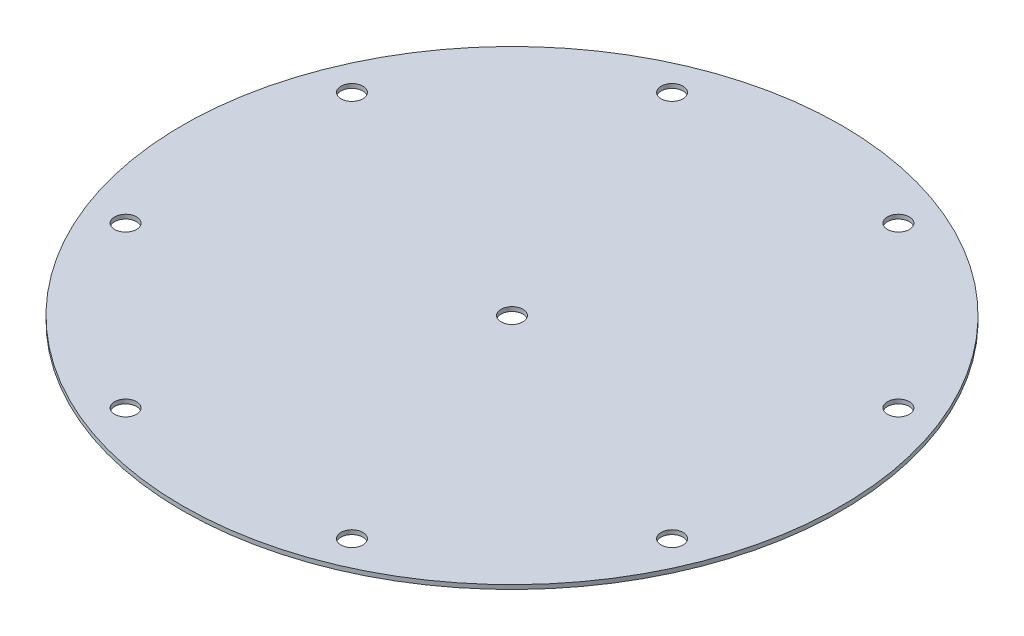
from build123d import *

# Parameters (mm, degrees)
SKETCH2_W                  = 77.99983
SKETCH2_H                  = 1
F_6_0_204_DIAMETER_HOLE1_D = 5.1816
CIRPATTERN3_COUNT          = 8
F_6_0_204_DIAMETER_HOLE2_D = 5.1816


with BuildPart() as part:
    # Sketch2 → Revolve1 (revolve)
    with BuildSketch(Plane(origin=(0, 0, 0), x_dir=(0, 0, -1), z_dir=(1, 0, 0))):
        with Locations((-38.999915, 0.5)):
            Rectangle(SKETCH2_W, SKETCH2_H)
    revolve(axis=Axis((0, -0.75, 0), (0, 1, 0)))

    # #6 (0.204) Diameter Hole1 (through all)
    with Locations(Plane(origin=(0, 1, 0), x_dir=(1, 0, 0), z_dir=(0, 1, 0))):
        with Locations((-26.787840266, 64.671567276)):
            f_6_0_204_diameter_hole1 = Hole(F_6_0_204_DIAMETER_HOLE1_D / 2)

    # CirPattern3: #6 (0.204) Diameter Hole1 ×8 about axis
    cirpattern3_axis = Axis((0, -0.75, 0), (0, 1, 0))
    for i in range(1, CIRPATTERN3_COUNT):
        add(f_6_0_204_diameter_hole1.rotate(cirpattern3_axis, i * 360 / CIRPATTERN3_COUNT), mode=Mode.SUBTRACT)

    # #6 (0.204) Diameter Hole2 (through all)
    with Locations(Plane(origin=(0, 1, 0), x_dir=(1, 0, 0), z_dir=(0, 1, 0))):
        with Locations((0, 0)):
            Hole(F_6_0_204_DIAMETER_HOLE2_D / 2)


solid = part.part
